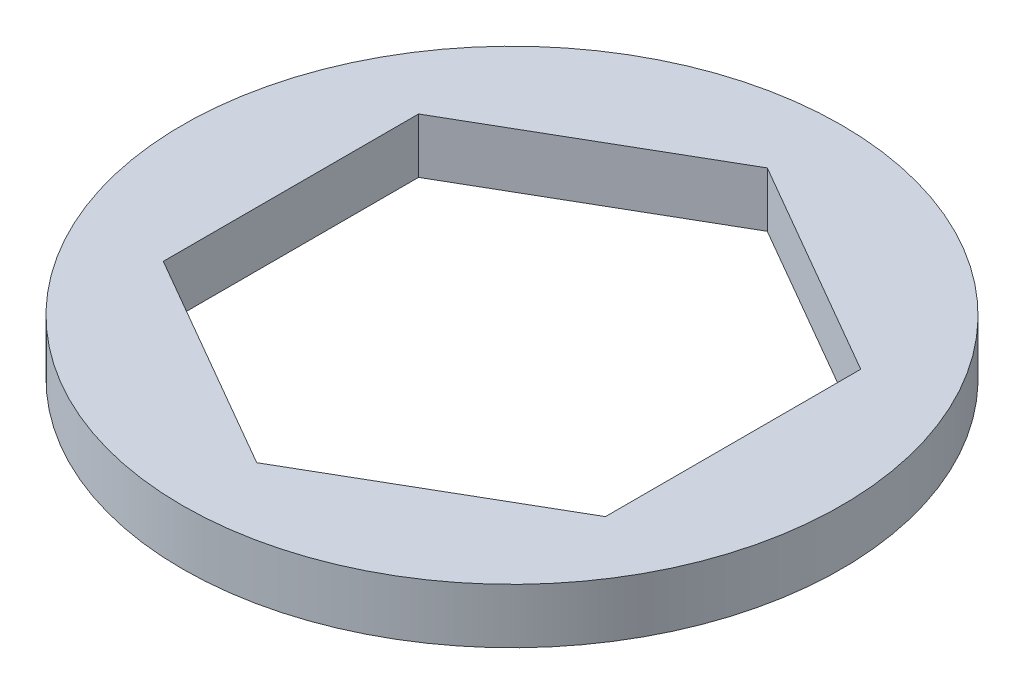
from build123d import *

# Parameters (mm, degrees)
SKETCH1_R           = 9.525
BOSS_EXTRUDE1_DEPTH = 1.5875


with BuildPart() as part:
    # Sketch1 → Boss-Extrude1 (new body)
    with BuildSketch(Plane(origin=(0, 0, 0), x_dir=(1, 0, 0), z_dir=(0, 1, 0))):
        Circle(SKETCH1_R)
        Polygon((6.3896875, 3.689087798), (0, 7.378175596), (-6.3896875, 3.689087798), (-6.3896875, -3.689087798), (0, -7.378175596), (6.3896875, -3.689087798), align=None, mode=Mode.SUBTRACT)
    extrude(amount=BOSS_EXTRUDE1_DEPTH)


solid = part.part
